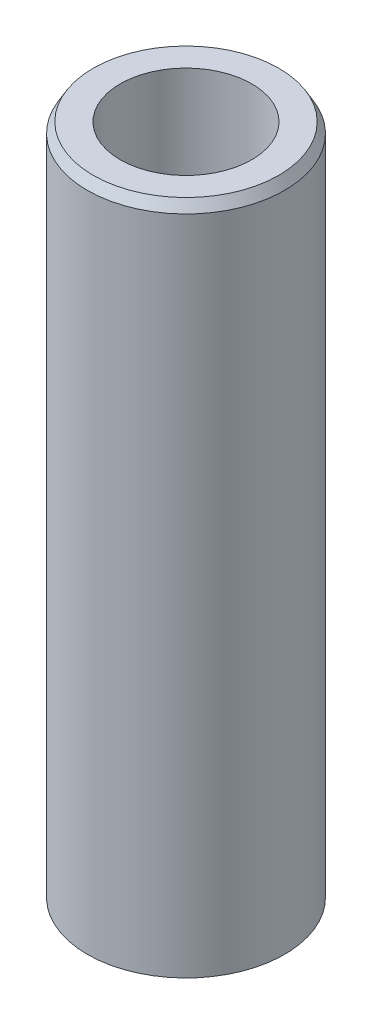
from build123d import *
from OCP.BRepFilletAPI import BRepFilletAPI_MakeChamfer

# Parameters (mm, degrees)
SKETCH1_R           = 50
BOSS_EXTRUDE1_DEPTH = 343.483602576
SKETCH2_R           = 33.353546126
CUT_EXTRUDE1_DEPTH  = 351.68644861
CHAMFER1_SIZE       = 5.132480081
CHAMFER1_SIZE2      = 2.963238756


with BuildPart() as part:
    # Sketch1 → Boss-Extrude1 (new body)
    with BuildSketch(Plane(origin=(0, 0, 0), x_dir=(1, 0, 0), z_dir=(0, 1, 0))):
        Circle(SKETCH1_R)
    extrude(amount=BOSS_EXTRUDE1_DEPTH)

    # Sketch2 → Cut-Extrude1 (cut, through all)
    with BuildSketch(Plane(origin=(0, 0, 0), x_dir=(1, 0, 0), z_dir=(0, 1, 0))):
        Circle(SKETCH2_R)
    extrude(amount=CUT_EXTRUDE1_DEPTH, mode=Mode.SUBTRACT)

    # Chamfer1: one chamfer whose edges measure the first distance from different faces: ONE call of the kernel's chamfer builder (chamfer() names one face for all edges)
    chamfer1_edges_1 = [part.edges().sort_by_distance(p)[0] for p in [
        (-50, 343.483602576, 0),
    ]]
    chamfer1_side_1 = [part.faces().sort_by_distance(p)[0] for p in [
        (-50, 171.741801288, 0),
    ]]
    chamfer1_edges_2 = [part.edges().sort_by_distance(p)[0] for p in [
        (-50, 0, 0),
    ]]
    chamfer1_side_2 = [part.faces().sort_by_distance(p)[0] for p in [
        (-48.585786438, 0, 0),
    ]]
    chamfer1 = BRepFilletAPI_MakeChamfer(part.part.solid().wrapped)
    for e in chamfer1_edges_1:
        chamfer1.Add(CHAMFER1_SIZE, CHAMFER1_SIZE2, e.wrapped, chamfer1_side_1[0].wrapped)  # the first distance lies on this face
    for e in chamfer1_edges_2:
        chamfer1.Add(CHAMFER1_SIZE, CHAMFER1_SIZE2, e.wrapped, chamfer1_side_2[0].wrapped)  # the first distance lies on this face
    add(Compound.cast(chamfer1.Shape()), mode=Mode.REPLACE)


solid = part.part
